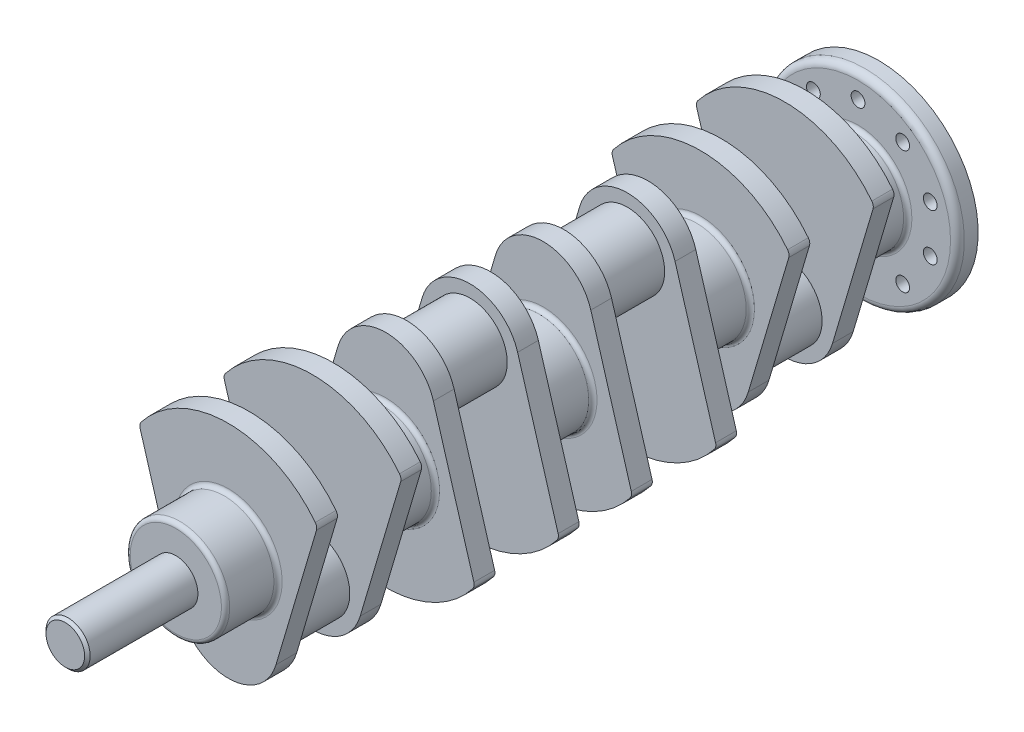
from build123d import *

# Parameters (mm, degrees)
SKETCH1_R             = 16
BOSS_EXTRUDE1_DEPTH   = 80
SKETCH2_R             = 36
BOSS_EXTRUDE2_DEPTH   = 38
BOSS_EXTRUDE3_DEPTH   = 15
SKETCH5_R             = 27
BOSS_EXTRUDE4_DEPTH   = 46
MIRROR4_START         = -266
MIRROR4_OUTLINE_R     = 36
MIRROR4_DEPTH         = 38
MIRROR4_START_2       = -228
MIRROR4_2_DEPTH       = 15
MIRROR4_START_3       = -213
MIRROR4_3_OUTLINE_R   = 27
MIRROR4_3_DEPTH       = 46
MIRROR4_START_4       = -167
MIRROR4_4_DEPTH       = 15
BODY_MOVE_COPY1_ANGLE = 180
SKETCH7_R             = 72
SKETCH7_R_2           = 5
BOSS_EXTRUDE5_DEPTH   = 15
FILLET1_R             = 3
CHAMFER1_SIZE         = 2
FILLET2_R             = 5
FILLET3_R             = 5


# Read off the part's stored shape, not the designer's step: Mirror4
with BuildPart() as part:
    # Sketch1 → Boss-Extrude1 (new body)
    with BuildSketch(Plane.XY):
        Circle(SKETCH1_R)
    extrude(amount=BOSS_EXTRUDE1_DEPTH)


with BuildPart() as body_2:
    # Sketch2 → Boss-Extrude2 (new body)
    with BuildSketch(Plane(origin=(0, 0, 0), x_dir=(-1, 0, 0), z_dir=(0, 0, -1))):
        Circle(SKETCH2_R)
    extrude(amount=BOSS_EXTRUDE2_DEPTH)


with BuildPart() as body_3:
    # Sketch4 → Boss-Extrude3 (new body)
    with BuildSketch(Plane(origin=(0, 0, -38), x_dir=(-1, 0, 0), z_dir=(0, 0, -1))):
        with BuildLine():
            Line((-64.569893475, 47.23059238), (-34.517510455, -54.224552409))
            ThreePointArc((-34.517510455, -54.224552409), (0, -80), (34.517510455, -54.224552409))
            Line((34.517510455, -54.224552409), (64.569893475, 47.23059238))
            ThreePointArc((64.569893475, 47.23059238), (0, 80), (-64.569893475, 47.23059238))
        make_face()
    extrude(amount=BOSS_EXTRUDE3_DEPTH)


with BuildPart() as body_4:
    # Sketch5 → Boss-Extrude4 (new body)
    with BuildSketch(Plane(origin=(0, 0, -53), x_dir=(-1, 0, 0), z_dir=(0, 0, -1))):
        with Locations((0, -44)):
            Circle(SKETCH5_R)
    extrude(amount=BOSS_EXTRUDE4_DEPTH)


with BuildPart() as body_5:
    # Mirror3: mirrored copy
    add(body_2.part.mirror(Plane(origin=(0, 0, -76), x_dir=(1, 0, 0), z_dir=(0, 0, -1))))


with BuildPart() as body_6:
    # Mirror3 2: mirrored copy
    add(body_3.part.mirror(Plane(origin=(0, 0, -76), x_dir=(1, 0, 0), z_dir=(0, 0, -1))))


with BuildPart() as body_7:
    # Mirror4 outline → Mirror4 (new body)
    with BuildSketch(Plane.XY.offset(MIRROR4_START)):
        Circle(MIRROR4_OUTLINE_R)
    extrude(amount=MIRROR4_DEPTH)


with BuildPart() as body_8:
    # Mirror4 2 outline → Mirror4 2 (new body)
    with BuildSketch(Plane.XY.offset(MIRROR4_START_2)):
        with BuildLine():
            ThreePointArc((64.569893475, 47.23059238), (0, 80), (-64.569893475, 47.23059238))
            Line((-64.569893475, 47.23059238), (-34.517510455, -54.224552409))
            ThreePointArc((-34.517510455, -54.224552409), (0, -80), (34.517510455, -54.224552409))
            Line((34.517510455, -54.224552409), (64.569893475, 47.23059238))
        make_face()
    extrude(amount=MIRROR4_2_DEPTH)


with BuildPart() as body_9:
    # Mirror4 3 outline → Mirror4 3 (new body)
    with BuildSketch(Plane.XY.offset(MIRROR4_START_3)):
        with Locations((0, -44)):
            Circle(MIRROR4_3_OUTLINE_R)
    extrude(amount=MIRROR4_3_DEPTH)


with BuildPart() as body_10:
    # Mirror4 4 outline → Mirror4 4 (new body)
    with BuildSketch(Plane.XY.offset(MIRROR4_START_4)):
        with BuildLine():
            Line((34.517510455, -54.224552409), (64.569893475, 47.23059238))
            ThreePointArc((64.569893475, 47.23059238), (0, 80), (-64.569893475, 47.23059238))
            Line((-64.569893475, 47.23059238), (-34.517510455, -54.224552409))
            ThreePointArc((-34.517510455, -54.224552409), (0, -80), (34.517510455, -54.224552409))
        make_face()
    extrude(amount=MIRROR4_4_DEPTH)


with BuildPart() as body_10_1:
    # Body-Move/Copy1: moved
    add(body_10.part.rotate(Axis((0, 0, -190), (1, 0, 0)), BODY_MOVE_COPY1_ANGLE))


with BuildPart() as body_9_1:
    # Body-Move/Copy1: moved
    add(body_9.part.rotate(Axis((0, 0, -190), (1, 0, 0)), BODY_MOVE_COPY1_ANGLE))


with BuildPart() as body_8_1:
    # Body-Move/Copy1: moved
    add(body_8.part.rotate(Axis((0, 0, -190), (1, 0, 0)), BODY_MOVE_COPY1_ANGLE))


with BuildPart() as body_11:
    # Mirror5: mirrored copy
    add(body_2.part.mirror(Plane(origin=(0, 0, -247), x_dir=(1, 0, 0), z_dir=(0, 0, -1))))

    # Sketch7 → Boss-Extrude5 (add)
    with BuildSketch(Plane(origin=(0, 0, -494), x_dir=(-1, 0, 0), z_dir=(0, 0, -1))):
        with Locations(Location((0, 0, 0), (0, 0, 90))):
            Circle(SKETCH7_R)
        with Locations(Location((0, 55, 0), (0, 0, 90))):
            Circle(SKETCH7_R_2, mode=Mode.SUBTRACT)
        with Locations(Location((32.328188876, 44.495934691, 0), (0, 0, 90))):
            Circle(SKETCH7_R_2, mode=Mode.SUBTRACT)
        with Locations(Location((52.308108396, 16.995934691, 0), (0, 0, 90))):
            Circle(SKETCH7_R_2, mode=Mode.SUBTRACT)
        with Locations(Location((52.308108396, -16.995934691, 0), (0, 0, 90))):
            Circle(SKETCH7_R_2, mode=Mode.SUBTRACT)
        with Locations(Location((32.328188876, -44.495934691, 0), (0, 0, 90))):
            Circle(SKETCH7_R_2, mode=Mode.SUBTRACT)
        with Locations(Location((0, -55, 0), (0, 0, 90))):
            Circle(SKETCH7_R_2, mode=Mode.SUBTRACT)
        with Locations(Location((-32.328188876, -44.495934691, 0), (0, 0, 90))):
            Circle(SKETCH7_R_2, mode=Mode.SUBTRACT)
        with Locations(Location((-52.308108396, -16.995934691, 0), (0, 0, 90))):
            Circle(SKETCH7_R_2, mode=Mode.SUBTRACT)
        with Locations(Location((-52.308108396, 16.995934691, 0), (0, 0, 90))):
            Circle(SKETCH7_R_2, mode=Mode.SUBTRACT)
        with Locations(Location((-32.328188876, 44.495934691, 0), (0, 0, 90))):
            Circle(SKETCH7_R_2, mode=Mode.SUBTRACT)
    extrude(amount=BOSS_EXTRUDE5_DEPTH)


with BuildPart() as body_12:
    # Mirror5 2: mirrored copy
    add(body_3.part.mirror(Plane(origin=(0, 0, -247), x_dir=(1, 0, 0), z_dir=(0, 0, -1))))


with BuildPart() as body_13:
    # Mirror5 3: mirrored copy
    add(body_6.part.mirror(Plane(origin=(0, 0, -247), x_dir=(1, 0, 0), z_dir=(0, 0, -1))))


with BuildPart() as body_14:
    # Mirror5 4: mirrored copy
    add(body_4.part.mirror(Plane(origin=(0, 0, -247), x_dir=(1, 0, 0), z_dir=(0, 0, -1))))


with BuildPart() as body_15:
    # Mirror5 5: mirrored copy
    add(body_5.part.mirror(Plane(origin=(0, 0, -247), x_dir=(1, 0, 0), z_dir=(0, 0, -1))))


with BuildPart() as body_16:
    # Mirror5 6: mirrored copy
    add(body_9_1.part.mirror(Plane(origin=(0, 0, -247), x_dir=(1, 0, 0), z_dir=(0, 0, -1))))


with BuildPart() as body_17:
    # Mirror5 7: mirrored copy
    add(body_8_1.part.mirror(Plane(origin=(0, 0, -247), x_dir=(1, 0, 0), z_dir=(0, 0, -1))))


with BuildPart() as body_18:
    # Mirror5 8: mirrored copy
    add(body_10_1.part.mirror(Plane(origin=(0, 0, -247), x_dir=(1, 0, 0), z_dir=(0, 0, -1))))


with BuildPart() as part_1:
    add(part.part)

    # Combine1: union body 2, body 3, body 6, body 4, body 8, body 5, body 10, body 9, body 7, body 18, body 16, body 15, body 17, body 13, body 12, body 11, body 14
    add(body_2.part)
    add(body_3.part)
    add(body_6.part)
    add(body_4.part)
    add(body_8_1.part)
    add(body_5.part)
    add(body_10_1.part)
    add(body_9_1.part)
    add(body_7.part)
    add(body_18.part)
    add(body_16.part)
    add(body_15.part)
    add(body_17.part)
    add(body_13.part)
    add(body_12.part)
    add(body_11.part)
    add(body_14.part)

    # Fillet1
    fillet1_edges = [part_1.edges().sort_by_distance(p)[0] for p in [
        (36, 0, -114),
        (36, 0, -152),
        (-36, 0, -228),
        (-36, 0, -266),
        (36, 0, -342),
        (36, 0, -380),
        (36, 0, -456),
        (36, 0, -494),
        (36, 0, 0),
        (36, 0, -38),
    ]]
    fillet(fillet1_edges, radius=FILLET1_R)

    # Chamfer1
    chamfer1_edges = [part_1.edges().sort_by_distance(p)[0] for p in [
        (-16, 0, 80),
    ]]
    chamfer(chamfer1_edges, length=CHAMFER1_SIZE)

    # Fillet2
    fillet2_edges = [part_1.edges().sort_by_distance(p)[0] for p in [
        (64.569893475, -47.23059238, -159.5),
        (-64.569893475, -47.23059238, -159.5),
        (-64.569893475, -47.23059238, -220.5),
        (64.569893475, -47.23059238, -220.5),
        (64.569893475, -47.23059238, -273.5),
        (-64.569893475, -47.23059238, -273.5),
        (-64.569893475, -47.23059238, -334.5),
        (64.569893475, -47.23059238, -334.5),
        (-64.569893475, 47.23059238, -387.5),
        (64.569893475, 47.23059238, -387.5),
        (64.569893475, 47.23059238, -448.5),
        (-64.569893475, 47.23059238, -448.5),
        (-64.569893475, 47.23059238, -45.5),
        (64.569893475, 47.23059238, -45.5),
        (64.569893475, 47.23059238, -106.5),
        (-64.569893475, 47.23059238, -106.5),
    ]]
    fillet(fillet2_edges, radius=FILLET2_R)

    # Fillet3
    fillet3_edges = [part_1.edges().sort_by_distance(p)[0] for p in [
        (0, -72, -494),
    ]]
    fillet(fillet3_edges, radius=FILLET3_R)


solid = part_1.part
